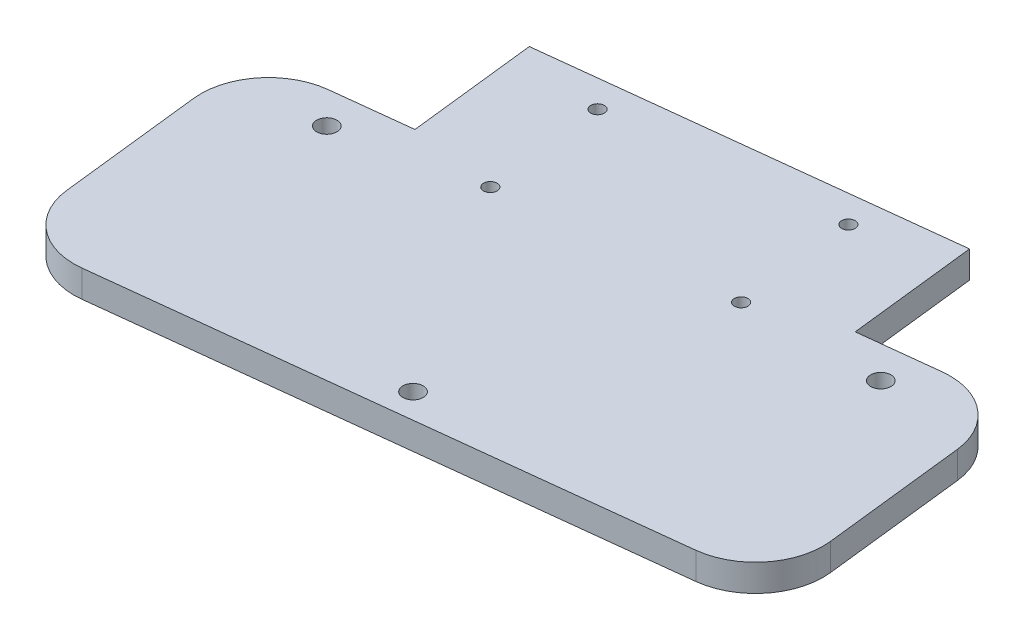
from build123d import *

# Parameters (mm, degrees)
SKETCH1_R           = 1.5
SKETCH1_R_2         = 1
BOSS_EXTRUDE1_DEPTH = 4
FILLET1_R           = 10
FILLET2_R           = 10
FILLET3_R           = 10
FILLET4_R           = 10


with BuildPart() as part:
    # Sketch1 → Boss-Extrude1 (new body)
    with BuildSketch(Plane(origin=(0, 0, 0), x_dir=(1, 0, 0), z_dir=(0, 1, 0))):
        Polygon((-43.595803766, -205.807188304), (-22.135109681, -203.371959758), (-24.298008335, -184.311199966), (34.130185477, -177.681125241), (36.293084131, -196.741885032), (57.753778216, -194.306656487), (62.409879754, -235.339014996), (-38.939702228, -246.839546813), align=None)
        with Locations((-29.093140713, -209.445179895)):
            Circle(SKETCH1_R, mode=Mode.SUBTRACT)
        with Locations((44.434987391, -201.101656812)):
            Circle(SKETCH1_R, mode=Mode.SUBTRACT)
        with Locations((11.278933321, -237.069365642)):
            Circle(SKETCH1_R, mode=Mode.SUBTRACT)
        with Locations((-9.197768444, -205.174739373)):
            Circle(SKETCH1_R_2, mode=Mode.SUBTRACT)
        with Locations((-11.22676603, -187.293996073)):
            Circle(SKETCH1_R_2, mode=Mode.SUBTRACT)
        with Locations((22.059616288, -183.516860623)):
            Circle(SKETCH1_R_2, mode=Mode.SUBTRACT)
        with Locations((24.088613874, -201.397603923)):
            Circle(SKETCH1_R_2, mode=Mode.SUBTRACT)
    extrude(amount=BOSS_EXTRUDE1_DEPTH)

    # Fillet1
    fillet1_edges = [part.edges().sort_by_distance(p)[0] for p in [
        (-38.939702228, 2, 246.839546813),
    ]]
    fillet(fillet1_edges, radius=FILLET1_R)

    # Fillet2
    fillet2_edges = [part.edges().sort_by_distance(p)[0] for p in [
        (62.409879754, 2, 235.339014996),
    ]]
    fillet(fillet2_edges, radius=FILLET2_R)

    # Fillet3
    fillet3_edges = [part.edges().sort_by_distance(p)[0] for p in [
        (57.753778216, 2, 194.306656487),
    ]]
    fillet(fillet3_edges, radius=FILLET3_R)

    # Fillet4
    fillet4_edges = [part.edges().sort_by_distance(p)[0] for p in [
        (-43.595803766, 2, 205.807188304),
    ]]
    fillet(fillet4_edges, radius=FILLET4_R)


solid = part.part
